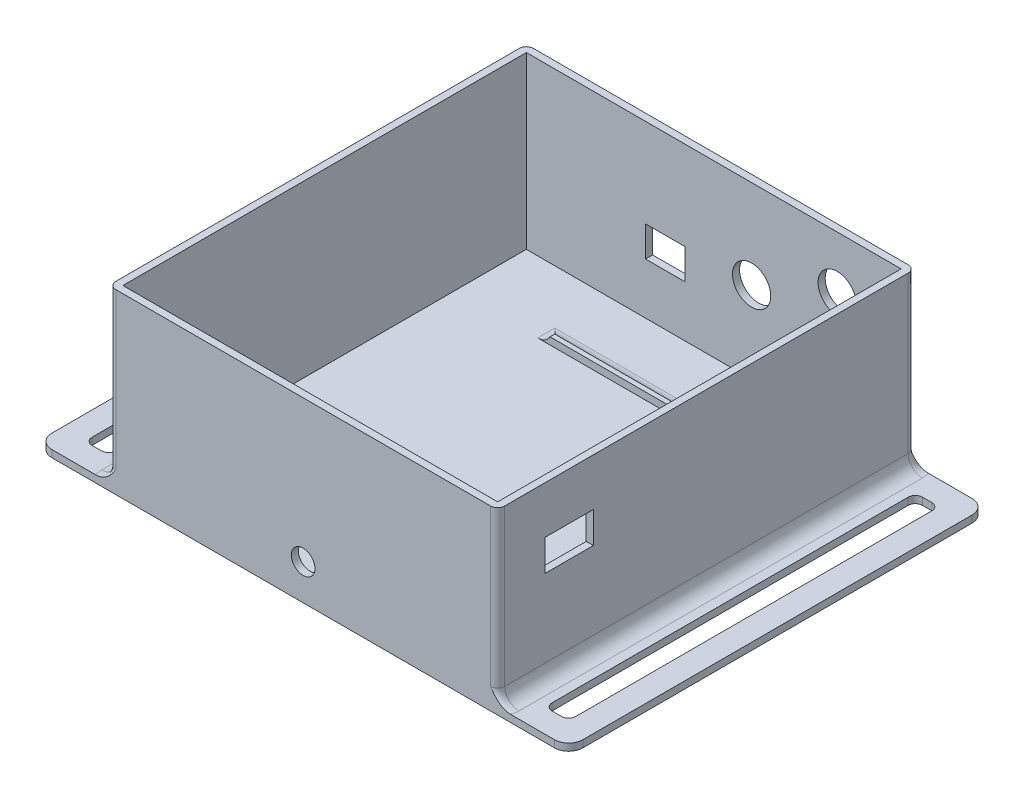
from build123d import *

# Parameters (mm, degrees)
SKETCH1_W           = 164.3
SKETCH1_H           = 176.44
SKETCH1_W_2         = 158.3
SKETCH1_H_2         = 170.44
BOSS_EXTRUDE1_DEPTH = 72
SKETCH2_W           = 164.3
SKETCH2_H           = 176.44
BOSS_EXTRUDE2_DEPTH = 3
SKETCH3_R           = 8.08
SKETCH3_W           = 16.72
SKETCH3_H           = 12.86
CUT_EXTRUDE1_DEPTH  = 3
SKETCH4_W           = 20.42
SKETCH4_H           = 13.18
CUT_EXTRUDE2_DEPTH  = 3
SKETCH5_R           = 5
CUT_EXTRUDE3_DEPTH  = 3
SKETCH6_W           = 176.44
SKETCH6_H           = 3
BOSS_EXTRUDE3_DEPTH = 30
SKETCH7_W           = 176.44
SKETCH7_H           = 3
BOSS_EXTRUDE4_DEPTH = 30
SKETCH9_W           = 10
SKETCH9_H           = 156.44
CUT_EXTRUDE4_DEPTH  = 169.791343641
SKETCH10_W          = 10
SKETCH10_H          = 156.44
CUT_EXTRUDE5_DEPTH  = 169.791343641
FILLET1_R           = 3
FILLET2_R           = 6
SKETCH11_W          = 78.3
SKETCH11_H          = 2
BOSS_EXTRUDE5_DEPTH = 3
FILLET3_R           = 6


with BuildPart() as part:
    # Sketch1 → Boss-Extrude1 (new body)
    with BuildSketch(Plane(origin=(0, 0, 0), x_dir=(1, 0, 0), z_dir=(0, 1, 0))):
        with Locations((8.94546986, -4.744535538)):
            Rectangle(SKETCH1_W, SKETCH1_H)
        with Locations((8.94546986, -4.744535538)):
            Rectangle(SKETCH1_W_2, SKETCH1_H_2, mode=Mode.SUBTRACT)
    extrude(amount=BOSS_EXTRUDE1_DEPTH)

    # Sketch2 → Boss-Extrude2 (add)
    with BuildSketch(Plane.XZ):
        with Locations((8.94546986, 4.744535538)):
            Rectangle(SKETCH2_W, SKETCH2_H)
    extrude(amount=BOSS_EXTRUDE2_DEPTH)

    # Sketch3 → Cut-Extrude1 (cut)
    with BuildSketch(Plane(origin=(0, 0, -83.475464462), x_dir=(-1, 0, 0), z_dir=(0, 0, -1))):
        with Locations((-61.09546986, 49.5)):
            Circle(SKETCH3_R)
        with Locations((-61.09546986, 19.5)):
            Circle(SKETCH3_R)
        with Locations((-24.93546986, 34.5)):
            Circle(SKETCH3_R)
        with Locations((11.50453014, 28.07)):
            Rectangle(SKETCH3_W, SKETCH3_H)
    extrude(amount=-CUT_EXTRUDE1_DEPTH, mode=Mode.SUBTRACT)

    # Sketch4 → Cut-Extrude2 (cut)
    with BuildSketch(Plane(origin=(91.09546986, 0, 0), x_dir=(0, 0, -1), z_dir=(1, 0, 0))):
        with Locations((-62.754535538, 45.41)):
            Rectangle(SKETCH4_W, SKETCH4_H)
    extrude(amount=-CUT_EXTRUDE2_DEPTH, mode=Mode.SUBTRACT)

    # Sketch5 → Cut-Extrude3 (cut)
    with BuildSketch(Plane.XY.offset(92.964535538)):
        with Locations((8.94546986, 12)):
            Circle(SKETCH5_R)
    extrude(amount=-CUT_EXTRUDE3_DEPTH, mode=Mode.SUBTRACT)

    # Sketch6 → Boss-Extrude3 (add)
    with BuildSketch(Plane.ZY.offset(73.20453014)):
        with Locations((4.744535538, -1.5)):
            Rectangle(SKETCH6_W, SKETCH6_H)
    extrude(amount=BOSS_EXTRUDE3_DEPTH)

    # Sketch7 → Boss-Extrude4 (add)
    with BuildSketch(Plane(origin=(91.09546986, 0, 0), x_dir=(0, 0, -1), z_dir=(1, 0, 0))):
        with Locations((-4.744535538, -1.5)):
            Rectangle(SKETCH7_W, SKETCH7_H)
    extrude(amount=BOSS_EXTRUDE4_DEPTH)

    # Sketch9 → Cut-Extrude4 (cut, through all)
    with BuildSketch(Plane(origin=(0, 0, 0), x_dir=(1, 0, 0), z_dir=(0, 1, 0))):
        with Locations((-88.20453014, -4.744535538)):
            Rectangle(SKETCH9_W, SKETCH9_H)
    extrude(amount=-CUT_EXTRUDE4_DEPTH, mode=Mode.SUBTRACT)

    # Sketch10 → Cut-Extrude5 (cut, through all)
    with BuildSketch(Plane(origin=(0, 0, 0), x_dir=(1, 0, 0), z_dir=(0, 1, 0))):
        with Locations((106.09546986, -4.744535538)):
            Rectangle(SKETCH10_W, SKETCH10_H)
    extrude(amount=-CUT_EXTRUDE5_DEPTH, mode=Mode.SUBTRACT)

    # Fillet1
    fillet1_edges = [part.edges().sort_by_distance(p)[0] for p in [
        (-83.20453014, -1.5, 82.964535538),
        (-93.20453014, -1.5, 82.964535538),
        (-93.20453014, -1.5, -73.475464462),
        (-83.20453014, -1.5, -73.475464462),
        (101.09546986, -1.5, -73.475464462),
        (111.09546986, -1.5, -73.475464462),
        (111.09546986, -1.5, 82.964535538),
        (101.09546986, -1.5, 82.964535538),
        (91.09546986, 36, -83.475464462),
        (91.09546986, 36, 92.964535538),
        (-73.20453014, 36, 92.964535538),
        (-73.20453014, 36, -83.475464462),
    ]]
    fillet(fillet1_edges, radius=FILLET1_R)

    # Fillet2
    # the kernel refuses this fillet: 6 mm, written as the material it adds along each edge
    with BuildSketch(Plane(origin=(-73.20453014, 0, 89.964535538), x_dir=(0, 1, 0), z_dir=(0, 0, -1)), Plane(origin=(91.09546986, 0, -80.475464462), x_dir=(0, 1, 0), z_dir=(0, 0, 1))) as fillet2_piece_1:
        with BuildLine():
            CenterArc((FILLET2_R, -FILLET2_R), FILLET2_R, 90, 90)
            Line((0, -FILLET2_R), (0, 0))
            Line((0, 0), (FILLET2_R, 0))
        make_face()
    extrude(amount=170.44)
    with BuildSketch(Plane(origin=(-70.20453014, 0, 89.964535538), x_dir=(-1, 0, 0), z_dir=(0, 0, -1))) as fillet2_piece_2_section:
        with BuildLine():
            CenterArc((3 + FILLET2_R, FILLET2_R), FILLET2_R, 180, 90)
            Line((3 + FILLET2_R, 0), (3, 0))
            Line((3, 0), (3, FILLET2_R))
        make_face()
    fillet2_piece_2 = revolve(axis=Axis((-70.20453014, 0, 89.964535538), (0, 1, 0)), revolution_arc=90, mode=Mode.PRIVATE)
    fillet2_piece_2 = split(fillet2_piece_2, bisect_by=Plane(origin=(-72.485257405, 2.132983428, 92.964535538), z_dir=(0, 0, -1)), keep=Keep.TOP, mode=Mode.PRIVATE)
    add(fillet2_piece_2)
    with BuildSketch(Plane(origin=(88.09546986, 0, 89.964535538), x_dir=(0, 0, 1), z_dir=(-1, 0, 0))) as fillet2_piece_3_section:
        with BuildLine():
            CenterArc((3 + FILLET2_R, FILLET2_R), FILLET2_R, 180, 90)
            Line((3, FILLET2_R), (3, 0))
            Line((3, 0), (3 + FILLET2_R, 0))
        make_face()
    fillet2_piece_3 = revolve(axis=Axis((88.09546986, 0, 89.964535538), (0, 1, 0)), revolution_arc=90, mode=Mode.PRIVATE)
    fillet2_piece_3 = split(fillet2_piece_3, bisect_by=Plane(origin=(90.376197118, 2.132983428, 92.964535538), z_dir=(0, 0, -1)), keep=Keep.TOP, mode=Mode.PRIVATE)
    add(fillet2_piece_3)
    with BuildSketch(Plane(origin=(88.09546986, 0, -80.475464462), x_dir=(0, 0, -1), z_dir=(-1, 0, 0))) as fillet2_piece_4_section:
        with BuildLine():
            CenterArc((3 + FILLET2_R, -FILLET2_R), FILLET2_R, 90, 90)
            Line((3, -FILLET2_R), (3, 0))
            Line((3, 0), (3 + FILLET2_R, 0))
        make_face()
    fillet2_piece_4 = revolve(axis=Axis((88.09546986, 0, -80.475464462), (0, -1, 0)), revolution_arc=90, mode=Mode.PRIVATE)
    fillet2_piece_4 = split(fillet2_piece_4, bisect_by=Plane(origin=(90.376233662, 2.13290724, -83.475464462), z_dir=(0, 0, 1)), keep=Keep.TOP, mode=Mode.PRIVATE)
    add(fillet2_piece_4)
    with BuildSketch(Plane(origin=(-70.20453014, 0, -80.475464462), x_dir=(-1, 0, 0), z_dir=(0, 0, 1))) as fillet2_piece_5_section:
        with BuildLine():
            CenterArc((3 + FILLET2_R, -FILLET2_R), FILLET2_R, 90, 90)
            Line((3 + FILLET2_R, 0), (3, 0))
            Line((3, 0), (3, -FILLET2_R))
        make_face()
    fillet2_piece_5 = revolve(axis=Axis((-70.20453014, 0, -80.475464462), (0, -1, 0)), revolution_arc=90, mode=Mode.PRIVATE)
    fillet2_piece_5 = split(fillet2_piece_5, bisect_by=Plane(origin=(-72.485257393, 2.132983423, -83.475464462), z_dir=(0, 0, 1)), keep=Keep.TOP, mode=Mode.PRIVATE)
    add(fillet2_piece_5)
    # the kernel refuses this fillet: 6 mm, written as the material it takes off along each edge
    with BuildSketch(Plane(origin=(121.09546986, 15, 92.964535538), x_dir=(-1, 0, 0), z_dir=(0, -1, 0)), Plane(origin=(121.09546986, -18, -83.475464462), x_dir=(-1, 0, 0), z_dir=(0, 1, 0)), Plane(origin=(-103.20453014, 15, -83.475464462), x_dir=(1, 0, 0), z_dir=(0, -1, 0)), Plane(origin=(-103.20453014, -18, 92.964535538), x_dir=(1, 0, 0), z_dir=(0, 1, 0))) as fillet2_2_piece_1:
        with BuildLine():
            CenterArc((FILLET2_R, FILLET2_R), FILLET2_R, 180, 90)
            Line((0, FILLET2_R), (0, 0))
            Line((0, 0), (FILLET2_R, 0))
        make_face()
    extrude(amount=33, mode=Mode.SUBTRACT)

    # Sketch11 → Boss-Extrude5 (add)
    with BuildSketch(Plane(origin=(0, 0, 0), x_dir=(1, 0, 0), z_dir=(0, 1, 0))):
        with Locations((8.94546986, 51.475464462)):
            Rectangle(SKETCH11_W, SKETCH11_H)
        with Locations((8.94546986, -60.964535538)):
            Rectangle(SKETCH11_W, SKETCH11_H)
    extrude(amount=BOSS_EXTRUDE5_DEPTH)

    # Fillet3
    # the kernel refuses this fillet: 6 mm, written as the material it adds along each edge
    with BuildSketch(Plane(origin=(48.09546986, 0, 61.964535538), x_dir=(0, 0, 1), z_dir=(-1, 0, 0))) as fillet3_piece_1:
        with BuildLine():
            CenterArc((5.196152423, 6), FILLET3_R, 210, 60)
            Line((0, 3), (-0.103923048, 2.94))
            ThreePointArc((-0.103923048, 2.94), (-0.12, 1.5), (-0.12, 0))
            Line((-0.12, 0), (0, -0.12))
            Line((0, -0.12), (5.196152423, -0.12))
            Line((5.196152423, -0.12), (5.196152423, 0))
        make_face()
    extrude(amount=78.3)
    with BuildSketch(Plane(origin=(48.09546986, 0, -52.475464462), x_dir=(0, 0, -1), z_dir=(-1, 0, 0))) as fillet3_piece_2:
        with BuildLine():
            CenterArc((5.196152423, -6), FILLET3_R, 90, 60)
            Line((0, -3), (-0.103923048, -2.94))
            ThreePointArc((-0.103923048, -2.94), (-0.12, -1.5), (-0.12, 0))
            Line((-0.12, 0), (0, 0.12))
            Line((0, 0.12), (5.196152423, 0.12))
            Line((5.196152423, 0.12), (5.196152423, 0))
        make_face()
    extrude(amount=78.3)
    with BuildSketch(Plane(origin=(-30.20453014, 0, 61.964535538), x_dir=(-1, 0, 0), z_dir=(0, 0, -1)), Plane(origin=(48.09546986, 0, 59.964535538), x_dir=(1, 0, 0), z_dir=(0, 0, 1))) as fillet3_piece_3:
        with BuildLine():
            CenterArc((5.196152423, 6), FILLET3_R, 210, 60)
            Line((0, 3), (-0.103923048, 2.94))
            ThreePointArc((-0.103923048, 2.94), (-0.12, 1.5), (-0.12, 0))
            Line((-0.12, 0), (0, -0.12))
            Line((0, -0.12), (5.196152423, -0.12))
            Line((5.196152423, -0.12), (5.196152423, 0))
        make_face()
    extrude(amount=2)
    with BuildSketch(Plane(origin=(48.09546986, 0, -50.475464462), x_dir=(1, 0, 0), z_dir=(0, 0, -1)), Plane(origin=(-30.20453014, 0, -52.475464462), x_dir=(-1, 0, 0), z_dir=(0, 0, 1))) as fillet3_piece_4:
        with BuildLine():
            CenterArc((5.196152423, -6), FILLET3_R, 90, 60)
            Line((0, -3), (-0.103923048, -2.94))
            ThreePointArc((-0.103923048, -2.94), (-0.12, -1.5), (-0.12, 0))
            Line((-0.12, 0), (0, 0.12))
            Line((0, 0.12), (5.196152423, 0.12))
            Line((5.196152423, 0.12), (5.196152423, 0))
        make_face()
    extrude(amount=2)
    with BuildSketch(Plane(origin=(48.09546986, 0, 59.964535538), x_dir=(1, 0, 0), z_dir=(0, 0, 1))) as fillet3_piece_5a_section:
        with BuildLine():
            CenterArc((5.196152423, 6), FILLET3_R, 210, 60)
            Line((0, 3), (-0.103923048, 2.94))
            ThreePointArc((-0.103923048, 2.94), (-0.12, 1.5), (-0.12, 0))
            Line((-0.12, 0), (0, -0.12))
            Line((0, -0.12), (5.196152423, -0.12))
            Line((5.196152423, -0.12), (5.196152423, 0))
        make_face()
    fillet3_piece_5a = extrude(amount=14.990381057, mode=Mode.PRIVATE)
    fillet3_piece_5a = split(fillet3_piece_5a, bisect_by=Plane(origin=(49.393332535, 0.777100266, 61.964535538), z_dir=(0, 0, 1)), keep=Keep.TOP, mode=Mode.PRIVATE)
    with BuildSketch(Plane(origin=(61.085850916, 0, 61.964535538), x_dir=(0, 0, 1), z_dir=(-1, 0, 0))) as fillet3_piece_5b_section:
        with BuildLine():
            CenterArc((5.196152423, 6), FILLET3_R, 210, 60)
            Line((0, 3), (-0.103923048, 2.94))
            ThreePointArc((-0.103923048, 2.94), (-0.12, 1.5), (-0.12, 0))
            Line((-0.12, 0), (0, -0.12))
            Line((0, -0.12), (5.196152423, -0.12))
            Line((5.196152423, -0.12), (5.196152423, 0))
        make_face()
    fillet3_piece_5b = extrude(amount=91.290381057, mode=Mode.PRIVATE)
    fillet3_piece_5b = split(fillet3_piece_5b, bisect_by=Plane(origin=(48.09546986, 0.777100266, 63.262398213), z_dir=(1, 0, 0)), keep=Keep.TOP, mode=Mode.PRIVATE)
    fillet3_piece_5 = fillet3_piece_5a & fillet3_piece_5b
    add(fillet3_piece_5)
    with BuildSketch(Plane(origin=(48.09546986, 0, 61.964535538), x_dir=(0, 0, 1), z_dir=(-1, 0, 0))) as fillet3_piece_6a_section:
        with BuildLine():
            CenterArc((5.196152423, 6), FILLET3_R, 210, 60)
            Line((0, 3), (-0.103923048, 2.94))
            ThreePointArc((-0.103923048, 2.94), (-0.12, 1.5), (-0.12, 0))
            Line((-0.12, 0), (0, -0.12))
            Line((0, -0.12), (5.196152423, -0.12))
            Line((5.196152423, -0.12), (5.196152423, 0))
        make_face()
    fillet3_piece_6a = extrude(amount=91.290381057, mode=Mode.PRIVATE)
    fillet3_piece_6a = split(fillet3_piece_6a, bisect_by=Plane(origin=(-30.20453014, 0.777100266, 63.262398213), z_dir=(-1, 0, 0)), keep=Keep.TOP, mode=Mode.PRIVATE)
    with BuildSketch(Plane(origin=(-30.20453014, 0, 74.954916594), x_dir=(-1, 0, 0), z_dir=(0, 0, -1))) as fillet3_piece_6b_section:
        with BuildLine():
            CenterArc((5.196152423, 6), FILLET3_R, 210, 60)
            Line((0, 3), (-0.103923048, 2.94))
            ThreePointArc((-0.103923048, 2.94), (-0.12, 1.5), (-0.12, 0))
            Line((-0.12, 0), (0, -0.12))
            Line((0, -0.12), (5.196152423, -0.12))
            Line((5.196152423, -0.12), (5.196152423, 0))
        make_face()
    fillet3_piece_6b = extrude(amount=14.990381057, mode=Mode.PRIVATE)
    fillet3_piece_6b = split(fillet3_piece_6b, bisect_by=Plane(origin=(-31.502392815, 0.777100266, 61.964535538), z_dir=(0, 0, 1)), keep=Keep.TOP, mode=Mode.PRIVATE)
    fillet3_piece_6 = fillet3_piece_6a & fillet3_piece_6b
    add(fillet3_piece_6)
    with BuildSketch(Plane(origin=(61.085850916, 0, -52.475464462), x_dir=(0, 0, -1), z_dir=(-1, 0, 0))) as fillet3_piece_7a_section:
        with BuildLine():
            CenterArc((5.196152423, -6), FILLET3_R, 90, 60)
            Line((0, -3), (-0.103923048, -2.94))
            ThreePointArc((-0.103923048, -2.94), (-0.12, -1.5), (-0.12, 0))
            Line((-0.12, 0), (0, 0.12))
            Line((0, 0.12), (5.196152423, 0.12))
            Line((5.196152423, 0.12), (5.196152423, 0))
        make_face()
    fillet3_piece_7a = extrude(amount=91.290381057, mode=Mode.PRIVATE)
    fillet3_piece_7a = split(fillet3_piece_7a, bisect_by=Plane(origin=(48.09546986, 0.777100266, -53.773327137), z_dir=(1, 0, 0)), keep=Keep.TOP, mode=Mode.PRIVATE)
    with BuildSketch(Plane(origin=(48.09546986, 0, -50.475464462), x_dir=(1, 0, 0), z_dir=(0, 0, -1))) as fillet3_piece_7b_section:
        with BuildLine():
            CenterArc((5.196152423, -6), FILLET3_R, 90, 60)
            Line((0, -3), (-0.103923048, -2.94))
            ThreePointArc((-0.103923048, -2.94), (-0.12, -1.5), (-0.12, 0))
            Line((-0.12, 0), (0, 0.12))
            Line((0, 0.12), (5.196152423, 0.12))
            Line((5.196152423, 0.12), (5.196152423, 0))
        make_face()
    fillet3_piece_7b = extrude(amount=14.990381057, mode=Mode.PRIVATE)
    fillet3_piece_7b = split(fillet3_piece_7b, bisect_by=Plane(origin=(49.393332535, 0.777100266, -52.475464462), z_dir=(0, 0, -1)), keep=Keep.TOP, mode=Mode.PRIVATE)
    fillet3_piece_7 = fillet3_piece_7a & fillet3_piece_7b
    add(fillet3_piece_7)
    with BuildSketch(Plane(origin=(-30.20453014, 0, -65.465845519), x_dir=(-1, 0, 0), z_dir=(0, 0, 1))) as fillet3_piece_8a_section:
        with BuildLine():
            CenterArc((5.196152423, -6), FILLET3_R, 90, 60)
            Line((0, -3), (-0.103923048, -2.94))
            ThreePointArc((-0.103923048, -2.94), (-0.12, -1.5), (-0.12, 0))
            Line((-0.12, 0), (0, 0.12))
            Line((0, 0.12), (5.196152423, 0.12))
            Line((5.196152423, 0.12), (5.196152423, 0))
        make_face()
    fillet3_piece_8a = extrude(amount=14.990381057, mode=Mode.PRIVATE)
    fillet3_piece_8a = split(fillet3_piece_8a, bisect_by=Plane(origin=(-31.502392815, 0.777100266, -52.475464462), z_dir=(0, 0, -1)), keep=Keep.TOP, mode=Mode.PRIVATE)
    with BuildSketch(Plane(origin=(48.09546986, 0, -52.475464462), x_dir=(0, 0, -1), z_dir=(-1, 0, 0))) as fillet3_piece_8b_section:
        with BuildLine():
            CenterArc((5.196152423, -6), FILLET3_R, 90, 60)
            Line((0, -3), (-0.103923048, -2.94))
            ThreePointArc((-0.103923048, -2.94), (-0.12, -1.5), (-0.12, 0))
            Line((-0.12, 0), (0, 0.12))
            Line((0, 0.12), (5.196152423, 0.12))
            Line((5.196152423, 0.12), (5.196152423, 0))
        make_face()
    fillet3_piece_8b = extrude(amount=91.290381057, mode=Mode.PRIVATE)
    fillet3_piece_8b = split(fillet3_piece_8b, bisect_by=Plane(origin=(-30.20453014, 0.777100266, -53.773327137), z_dir=(-1, 0, 0)), keep=Keep.TOP, mode=Mode.PRIVATE)
    fillet3_piece_8 = fillet3_piece_8a & fillet3_piece_8b
    add(fillet3_piece_8)


solid = part.part
